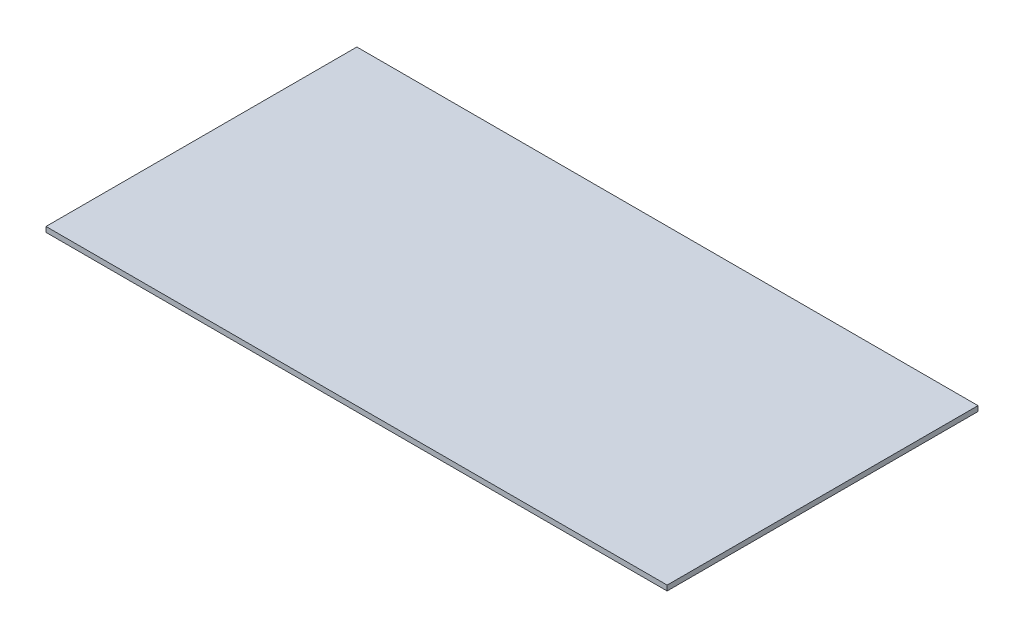
from build123d import *

# Parameters (mm, degrees)
SKETCH1_W           = 361.680820011
SKETCH1_H           = 181
BOSS_EXTRUDE1_DEPTH = 3


with BuildPart() as part:
    # Sketch1 → Boss-Extrude1 (new body)
    with BuildSketch(Plane(origin=(0, 0, 0), x_dir=(1, 0, 0), z_dir=(0, 1, 0))):
        with Locations((139.618606387, 90.5)):
            Rectangle(SKETCH1_W, SKETCH1_H)
    extrude(amount=BOSS_EXTRUDE1_DEPTH)


solid = part.part
